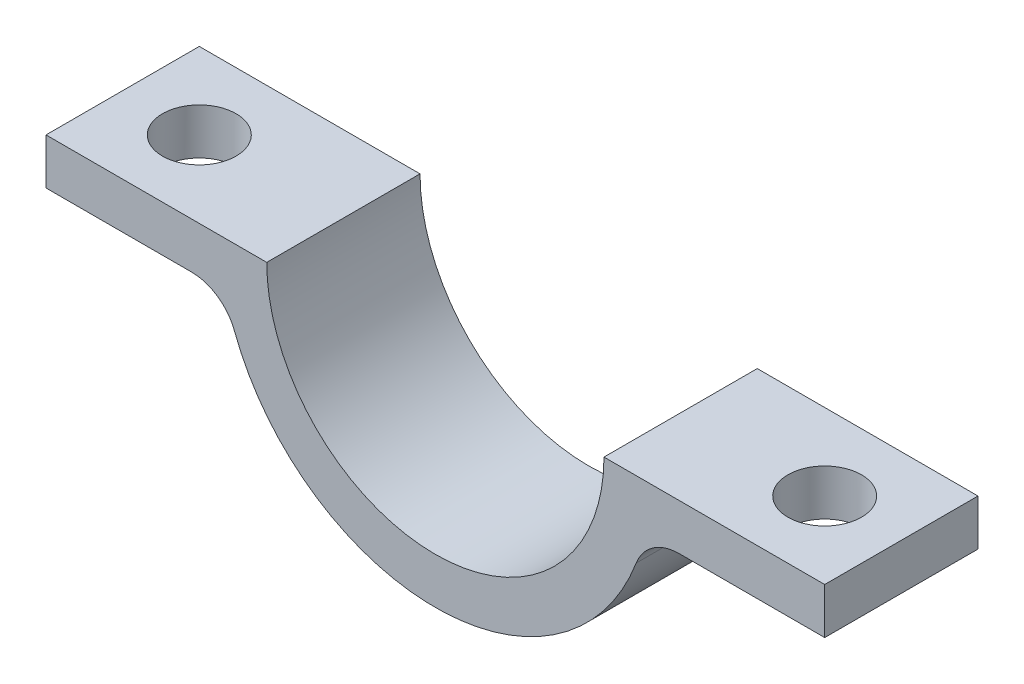
from build123d import *

# Parameters (mm, degrees)
BOSS_EXTRUDE1_DEPTH = 2.5
SKETCH2_R           = 1.2
CUT_EXTRUDE1_DEPTH  = 15.715298162
FILLET1_R           = 1.5


with BuildPart() as part:
    # Sketch1 → Boss-Extrude1 (new, symmetric)
    with BuildSketch(Plane.XY):
        with BuildLine():
            Line((5.5, 0), (12.7, 0))
            Line((12.7, 0), (12.7, -1.5))
            Line((12.7, -1.5), (6.837397166, -1.5))
            ThreePointArc((6.837397166, -1.5), (0, -7), (-6.837397166, -1.5))
            Line((-6.837397166, -1.5), (-12.7, -1.5))
            Line((-12.7, -1.5), (-12.7, 0))
            Line((-12.7, 0), (-5.5, 0))
            ThreePointArc((-5.5, 0), (0, -5.5), (5.5, 0))
        make_face()
    extrude(amount=BOSS_EXTRUDE1_DEPTH, both=True)

    # Sketch2 → Cut-Extrude1 (cut, through all)
    with BuildSketch(Plane(origin=(0, 0, 0), x_dir=(1, 0, 0), z_dir=(0, 1, 0))):
        with Locations((-10.2, 0)):
            Circle(SKETCH2_R)
        with Locations((10.2, 0)):
            Circle(SKETCH2_R)
    extrude(amount=-CUT_EXTRUDE1_DEPTH, mode=Mode.SUBTRACT)

    # Fillet1
    fillet1_edges = [part.edges().sort_by_distance(p)[0] for p in [
        (6.837397166, -1.5, 0),
        (-6.837397166, -1.5, 0),
    ]]
    fillet(fillet1_edges, radius=FILLET1_R)


solid = part.part
